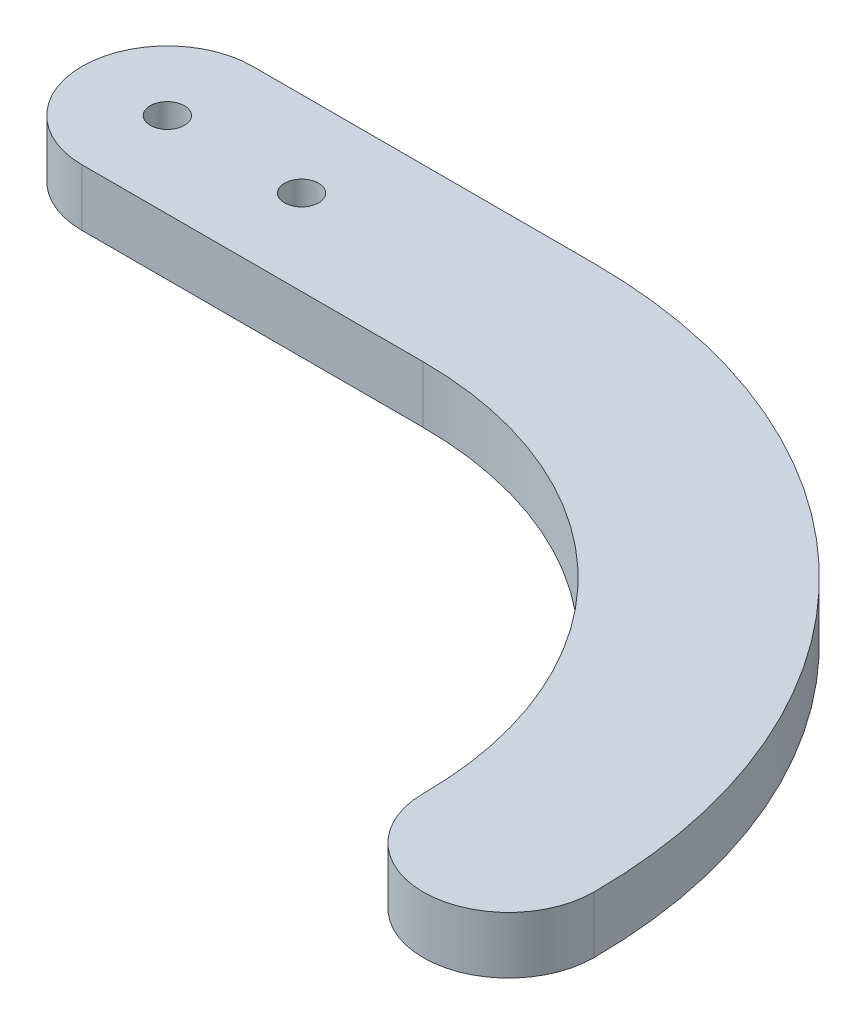
from build123d import *

# Parameters (mm, degrees)
SKETCH1_R           = 1.5
BOSS_EXTRUDE1_DEPTH = 5


with BuildPart() as part:
    # Sketch1 → Boss-Extrude1 (new body)
    with BuildSketch(Plane(origin=(0, 0, 0), x_dir=(1, 0, 0), z_dir=(0, 1, 0))):
        with BuildLine():
            Line((30, 7.5), (0, 7.5))
            ThreePointArc((0, 7.5), (-7.5, 0), (0, -7.5))
            Line((0, -7.5), (30, -7.5))
            ThreePointArc((30, -7.5), (53.246135432, -17.128864568), (62.875, -40.375))
            ThreePointArc((62.875, -40.375), (70.375, -47.875), (77.875, -40.375))
            ThreePointArc((77.875, -40.375), (63.852737149, -6.522262851), (30, 7.5))
        make_face()
        Circle(SKETCH1_R, mode=Mode.SUBTRACT)
        with Locations((11.8, 0)):
            Circle(SKETCH1_R, mode=Mode.SUBTRACT)
    extrude(amount=BOSS_EXTRUDE1_DEPTH)


solid = part.part
